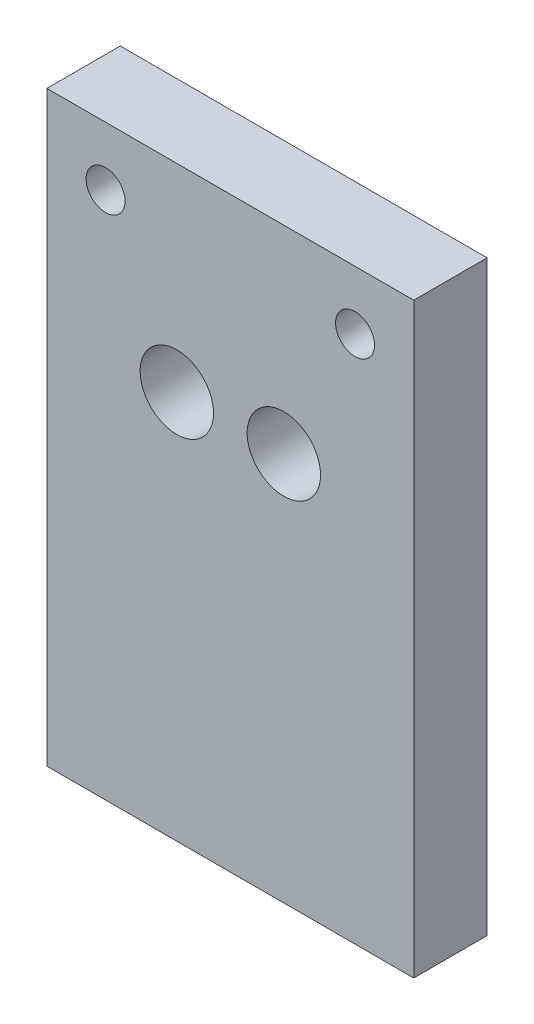
from build123d import *

# Parameters (mm, degrees)
SKETCH1_W               = 63.5
SKETCH1_H               = 134.62
SKETCH1_R               = 6.35
BOSS_EXTRUDE1_DEPTH     = 12.7
SKETCH2_W               = 63.5
SKETCH2_H               = 33.02
CUT_EXTRUDE1_DEPTH      = 76.498268854
F_1_4_CLEARANCE_HOLE1_D = 6.7564


with BuildPart() as part:
    # Sketch1 → Boss-Extrude1 (new body)
    with BuildSketch(Plane.XY):
        Rectangle(SKETCH1_W, SKETCH1_H)
        with Locations((-9.26084, 0)):
            Circle(SKETCH1_R, mode=Mode.SUBTRACT)
        with Locations((9.26084, 0)):
            Circle(SKETCH1_R, mode=Mode.SUBTRACT)
    extrude(amount=BOSS_EXTRUDE1_DEPTH)

    # Sketch2 → Cut-Extrude1 (cut, through all)
    with BuildSketch(Plane.XY.offset(12.7)):
        with Locations((0, 50.8)):
            Rectangle(SKETCH2_W, SKETCH2_H)
    extrude(amount=-CUT_EXTRUDE1_DEPTH, mode=Mode.SUBTRACT)

    # 1/4 Clearance Hole1 (through all)
    with Locations(Plane.XY.offset(12.7)):
        with Locations((-21.59, 24.13)):
            f_1_4_clearance_hole1 = Hole(F_1_4_CLEARANCE_HOLE1_D / 2)

    # Mirror1: 1/4 Clearance Hole1 across plane
    add(f_1_4_clearance_hole1.mirror(Plane(origin=(0, 0, 0), x_dir=(0, 0, 1), z_dir=(1, 0, 0))), mode=Mode.SUBTRACT)


solid = part.part
